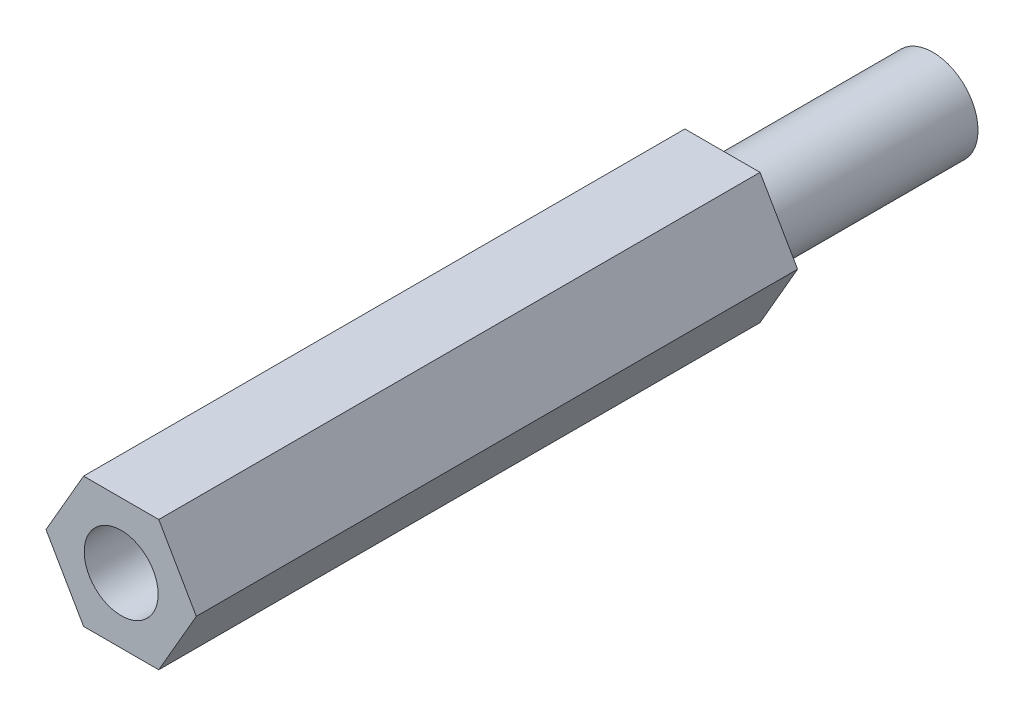
from build123d import *

# Parameters (mm, degrees)
ESTRUSIONE_ESTRUSIONE1_DEPTH = 20
SCHIZZO2_R                   = 1.5
ESTRUSIONE_ESTRUSIONE2_DEPTH = 7
FORO1_D                      = 2.459
FORO1_DEPTH                  = 7


with BuildPart() as part:
    # Schizzo1 → Estrusione-Estrusione1 (new body)
    with BuildSketch(Plane.XY):
        Polygon((1.25, -2.165063509), (2.5, 0), (1.25, 2.165063509), (-1.25, 2.165063509), (-2.5, 0), (-1.25, -2.165063509), align=None)
    extrude(amount=-ESTRUSIONE_ESTRUSIONE1_DEPTH)

    # Schizzo2 → Estrusione-Estrusione2 (add)
    with BuildSketch(Plane(origin=(0, 0, -20), x_dir=(-1, 0, 0), z_dir=(0, 0, -1))):
        Circle(SCHIZZO2_R)
    extrude(amount=ESTRUSIONE_ESTRUSIONE2_DEPTH)

    # Foro1
    with Locations(Plane.XY):
        with Locations((0, 0)):
            Hole(FORO1_D / 2, depth=FORO1_DEPTH)


solid = part.part
